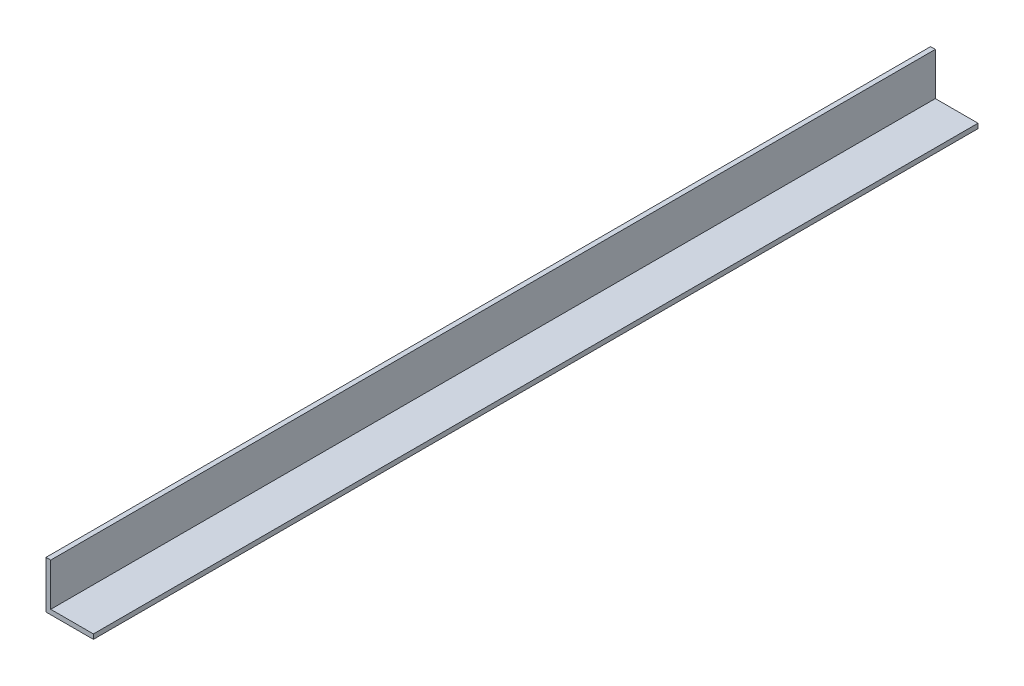
from build123d import *

# Parameters (mm, degrees)
BOSS_EXTRUDE1_DEPTH = 280


with BuildPart() as part:
    # Sketch1 → Boss-Extrude1 (new body)
    with BuildSketch(Plane.XY):
        Polygon((0, 0), (15, 0), (15, 1.5), (1.5, 1.5), (1.5, 15), (0, 15), align=None)
    extrude(amount=BOSS_EXTRUDE1_DEPTH)


solid = part.part
